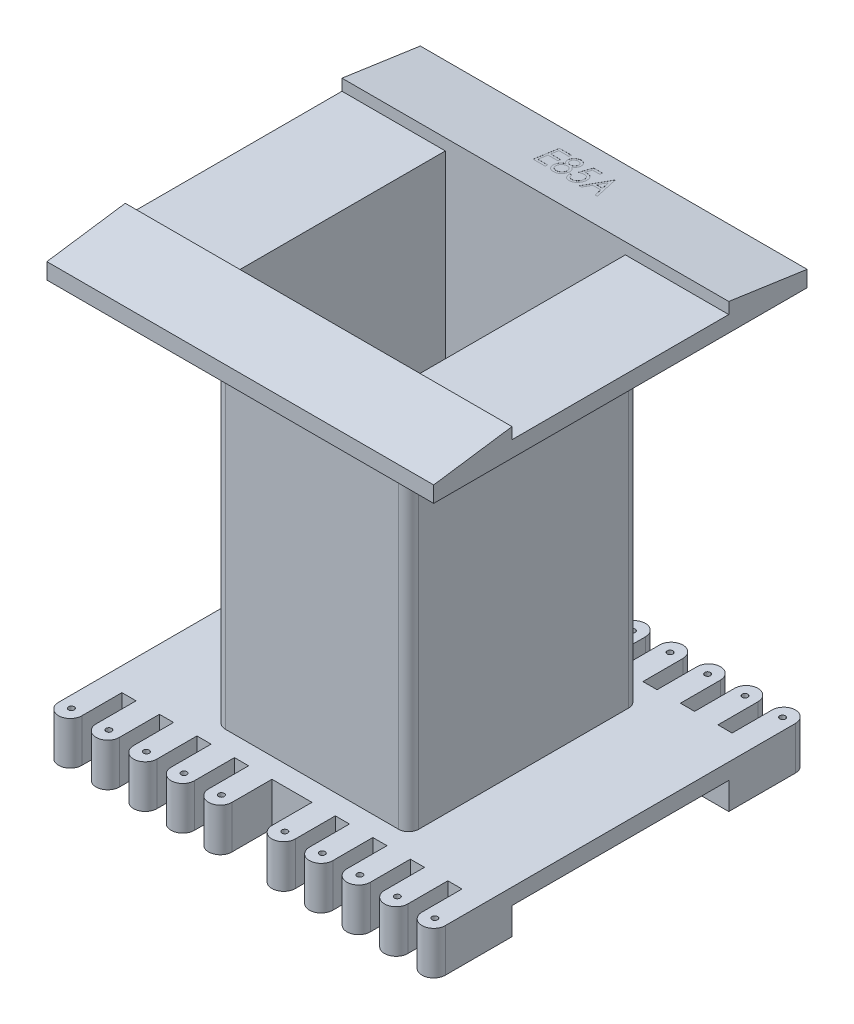
from build123d import *

# Parameters (mm, degrees)
SKETCH2_W           = 29
SKETCH2_H           = 34.5
SKETCH2_W_2         = 27
SKETCH2_H_2         = 32.5
BOSS_EXTRUDE1_DEPTH = 27.85
SKETCH4_W           = 58
SKETCH4_H           = 56
SKETCH4_W_2         = 27
SKETCH4_H_2         = 32.5
BOSS_EXTRUDE2_DEPTH = 2.4
BOSS_EXTRUDE3_DEPTH = 29
SKETCH7_R           = 0.425
CUT_EXTRUDE1_DEPTH  = 3
BOSS_EXTRUDE4_START = 4.05
BOSS_EXTRUDE4_DEPTH = 4.05
CUT_EXTRUDE2_DEPTH  = 0.01
CUT_EXTRUDE3_START  = -10
SKETCH10_R          = 0.425
CUT_EXTRUDE3_DEPTH  = 10
FILLET1_R           = 1.5


with BuildPart() as part:
    # Sketch2 → Boss-Extrude1 (new, symmetric)
    with BuildSketch(Plane(origin=(0, 0, 0), x_dir=(1, 0, 0), z_dir=(0, 1, 0))):
        Rectangle(SKETCH2_W, SKETCH2_H)
        Rectangle(SKETCH2_W_2, SKETCH2_H_2, mode=Mode.SUBTRACT)
    extrude(amount=BOSS_EXTRUDE1_DEPTH, both=True)

    # Sketch4 → Boss-Extrude2 (add)
    with BuildSketch(Plane(origin=(0, 27.85, 0), x_dir=(1, 0, 0), z_dir=(0, 1, 0))):
        Rectangle(SKETCH4_W, SKETCH4_H)
        Rectangle(SKETCH4_W_2, SKETCH4_H_2, mode=Mode.SUBTRACT)
    boss_extrude2 = extrude(amount=BOSS_EXTRUDE2_DEPTH)

    # Mirror1: Boss-Extrude2 across plane
    add(boss_extrude2.mirror(Plane.ZX))

    # Sketch5 → Boss-Extrude3 (add, symmetric)
    with BuildSketch(Plane(origin=(0, 0, 0), x_dir=(0, 0, -1), z_dir=(1, 0, 0))):
        Polygon((-28, 30.25), (-16.25, 31.95), (-16.25, 30.25), align=None)
        Polygon((28, 30.25), (16.25, 31.95), (16.25, 30.25), align=None)
    extrude(amount=BOSS_EXTRUDE3_DEPTH, both=True)

    # Sketch7 → Cut-Extrude1 (cut)
    with BuildSketch(Plane.XZ.offset(30.25)):
        with Locations((-27.25, 26.075)):
            Circle(SKETCH7_R)
        with Locations((-21.625, 26.075)):
            Circle(SKETCH7_R)
        with Locations((-16, 26.075)):
            Circle(SKETCH7_R)
        with Locations((-10.375, 26.075)):
            Circle(SKETCH7_R)
        with Locations((-4.75, 26.075)):
            Circle(SKETCH7_R)
        with Locations((21.625, 26.075)):
            Circle(SKETCH7_R)
        with Locations((16, 26.075)):
            Circle(SKETCH7_R)
        with Locations((10.375, 26.075)):
            Circle(SKETCH7_R)
        with Locations((4.75, 26.075)):
            Circle(SKETCH7_R)
        with Locations((27.25, 26.075)):
            Circle(SKETCH7_R)
        with Locations((27.25, -26.075)):
            Circle(SKETCH7_R)
        with Locations((4.75, -26.075)):
            Circle(SKETCH7_R)
        with Locations((10.375, -26.075)):
            Circle(SKETCH7_R)
        with Locations((16, -26.075)):
            Circle(SKETCH7_R)
        with Locations((21.625, -26.075)):
            Circle(SKETCH7_R)
        with Locations((-4.75, -26.075)):
            Circle(SKETCH7_R)
        with Locations((-10.375, -26.075)):
            Circle(SKETCH7_R)
        with Locations((-16, -26.075)):
            Circle(SKETCH7_R)
        with Locations((-21.625, -26.075)):
            Circle(SKETCH7_R)
        with Locations((-27.25, -26.075)):
            Circle(SKETCH7_R)
        with BuildLine():
            Line((-29, 28), (-29, 26.25))
            ThreePointArc((-29, 26.25), (-27.25, 28), (-25.5, 26.25))
            Line((-25.5, 26.25), (-25.5, 20.25))
            Line((-25.5, 20.25), (-23.375, 20.25))
            Line((-23.375, 20.25), (-23.375, 26.25))
            ThreePointArc((-23.375, 26.25), (-21.625, 28), (-19.875, 26.25))
            Line((-19.875, 26.25), (-19.875, 20.25))
            Line((-19.875, 20.25), (-17.75, 20.25))
            Line((-17.75, 20.25), (-17.75, 26.25))
            ThreePointArc((-17.75, 26.25), (-16, 28), (-14.25, 26.25))
            Line((-14.25, 26.25), (-14.25, 20.25))
            Line((-14.25, 20.25), (-12.125, 20.25))
            Line((-12.125, 20.25), (-12.125, 26.25))
            ThreePointArc((-12.125, 26.25), (-10.375, 28), (-8.625, 26.25))
            Line((-8.625, 26.25), (-8.625, 20.25))
            Line((-8.625, 20.25), (-6.5, 20.25))
            Line((-6.5, 20.25), (-6.5, 26.25))
            ThreePointArc((-6.5, 26.25), (-4.75, 28), (-3, 26.25))
            Line((-3, 26.25), (-3, 20.25))
            Line((-3, 20.25), (3, 20.25))
            Line((3, 20.25), (3, 26.25))
            ThreePointArc((3, 26.25), (4.75, 28), (6.5, 26.25))
            Line((6.5, 26.25), (6.5, 20.25))
            Line((6.5, 20.25), (8.625, 20.25))
            Line((8.625, 20.25), (8.625, 26.25))
            ThreePointArc((8.625, 26.25), (10.375, 28), (12.125, 26.25))
            Line((12.125, 26.25), (12.125, 20.25))
            Line((12.125, 20.25), (14.25, 20.25))
            Line((14.25, 20.25), (14.25, 26.25))
            ThreePointArc((14.25, 26.25), (16, 28), (17.75, 26.25))
            Line((17.75, 26.25), (17.75, 20.25))
            Line((17.75, 20.25), (19.875, 20.25))
            Line((19.875, 20.25), (19.875, 26.25))
            ThreePointArc((19.875, 26.25), (21.625, 28), (23.375, 26.25))
            Line((23.375, 26.25), (23.375, 20.25))
            Line((23.375, 20.25), (25.5, 20.25))
            Line((25.5, 20.25), (25.5, 26.25))
            ThreePointArc((25.5, 26.25), (27.25, 28), (29, 26.25))
            Line((29, 26.25), (29, 29.25))
            Line((29, 29.25), (-29, 29.25))
            Line((-29, 29.25), (-29, 28))
        make_face()
        with BuildLine():
            Line((3, -20.25), (3, -26.25))
            ThreePointArc((3, -26.25), (4.75, -28), (6.5, -26.25))
            Line((6.5, -26.25), (6.5, -20.25))
            Line((6.5, -20.25), (8.625, -20.25))
            Line((8.625, -20.25), (8.625, -26.25))
            ThreePointArc((8.625, -26.25), (10.375, -28), (12.125, -26.25))
            Line((12.125, -26.25), (12.125, -20.25))
            Line((12.125, -20.25), (14.25, -20.25))
            Line((14.25, -20.25), (14.25, -26.25))
            ThreePointArc((14.25, -26.25), (16, -28), (17.75, -26.25))
            Line((17.75, -26.25), (17.75, -20.25))
            Line((17.75, -20.25), (19.875, -20.25))
            Line((19.875, -20.25), (19.875, -26.25))
            ThreePointArc((19.875, -26.25), (21.625, -28), (23.375, -26.25))
            Line((23.375, -26.25), (23.375, -20.25))
            Line((23.375, -20.25), (25.5, -20.25))
            Line((25.5, -20.25), (25.5, -26.25))
            ThreePointArc((25.5, -26.25), (27.25, -28), (29, -26.25))
            Line((29, -26.25), (29, -29.25))
            Line((29, -29.25), (-29, -29.25))
            Line((-29, -29.25), (-29, -28))
            Line((-29, -28), (-29, -26.25))
            ThreePointArc((-29, -26.25), (-27.25, -28), (-25.5, -26.25))
            Line((-25.5, -26.25), (-25.5, -20.25))
            Line((-25.5, -20.25), (-23.375, -20.25))
            Line((-23.375, -20.25), (-23.375, -26.25))
            ThreePointArc((-23.375, -26.25), (-21.625, -28), (-19.875, -26.25))
            Line((-19.875, -26.25), (-19.875, -20.25))
            Line((-19.875, -20.25), (-17.75, -20.25))
            Line((-17.75, -20.25), (-17.75, -26.25))
            ThreePointArc((-17.75, -26.25), (-16, -28), (-14.25, -26.25))
            Line((-14.25, -26.25), (-14.25, -20.25))
            Line((-14.25, -20.25), (-12.125, -20.25))
            Line((-12.125, -20.25), (-12.125, -26.25))
            ThreePointArc((-12.125, -26.25), (-10.375, -28), (-8.625, -26.25))
            Line((-8.625, -26.25), (-8.625, -20.25))
            Line((-8.625, -20.25), (-6.5, -20.25))
            Line((-6.5, -20.25), (-6.5, -26.25))
            ThreePointArc((-6.5, -26.25), (-4.75, -28), (-3, -26.25))
            Line((-3, -26.25), (-3, -20.25))
            Line((-3, -20.25), (3, -20.25))
        make_face()
    extrude(amount=-CUT_EXTRUDE1_DEPTH, mode=Mode.SUBTRACT)

    # Sketch8 → Boss-Extrude4 (add)
    with BuildSketch(Plane.XZ.offset(30.25).offset(BOSS_EXTRUDE4_START)):
        with BuildLine():
            Line((-29, 16.25), (29, 16.25))
            Line((29, 16.25), (29, 26.25))
            ThreePointArc((29, 26.25), (27.25, 28), (25.5, 26.25))
            Line((25.5, 26.25), (25.5, 20.25))
            Line((25.5, 20.25), (23.375, 20.25))
            Line((23.375, 20.25), (23.375, 26.25))
            ThreePointArc((23.375, 26.25), (21.625, 28), (19.875, 26.25))
            Line((19.875, 26.25), (19.875, 20.25))
            Line((19.875, 20.25), (17.75, 20.25))
            Line((17.75, 20.25), (17.75, 26.25))
            ThreePointArc((17.75, 26.25), (16, 28), (14.25, 26.25))
            Line((14.25, 26.25), (14.25, 20.25))
            Line((14.25, 20.25), (12.125, 20.25))
            Line((12.125, 20.25), (12.125, 26.25))
            ThreePointArc((12.125, 26.25), (10.375, 28), (8.625, 26.25))
            Line((8.625, 26.25), (8.625, 20.25))
            Line((8.625, 20.25), (6.5, 20.25))
            Line((6.5, 20.25), (6.5, 26.25))
            ThreePointArc((6.5, 26.25), (4.75, 28), (3, 26.25))
            Line((3, 26.25), (3, 20.25))
            Line((3, 20.25), (-3, 20.25))
            Line((-3, 20.25), (-3, 26.25))
            ThreePointArc((-3, 26.25), (-4.75, 28), (-6.5, 26.25))
            Line((-6.5, 26.25), (-6.5, 20.25))
            Line((-6.5, 20.25), (-8.625, 20.25))
            Line((-8.625, 20.25), (-8.625, 26.25))
            ThreePointArc((-8.625, 26.25), (-10.375, 28), (-12.125, 26.25))
            Line((-12.125, 26.25), (-12.125, 20.25))
            Line((-12.125, 20.25), (-14.25, 20.25))
            Line((-14.25, 20.25), (-14.25, 26.25))
            ThreePointArc((-14.25, 26.25), (-16, 28), (-17.75, 26.25))
            Line((-17.75, 26.25), (-17.75, 20.25))
            Line((-17.75, 20.25), (-19.875, 20.25))
            Line((-19.875, 20.25), (-19.875, 26.25))
            ThreePointArc((-19.875, 26.25), (-21.625, 28), (-23.375, 26.25))
            Line((-23.375, 26.25), (-23.375, 20.25))
            Line((-23.375, 20.25), (-25.5, 20.25))
            Line((-25.5, 20.25), (-25.5, 26.25))
            ThreePointArc((-25.5, 26.25), (-27.25, 28), (-29, 26.25))
            Line((-29, 26.25), (-29, 16.25))
        make_face()
        with BuildLine():
            Line((-25.5, -20.25), (-25.5, -26.25))
            ThreePointArc((-25.5, -26.25), (-27.25, -28), (-29, -26.25))
            Line((-29, -26.25), (-29, -16.25))
            Line((-29, -16.25), (29, -16.25))
            Line((29, -16.25), (29, -26.25))
            ThreePointArc((29, -26.25), (27.25, -28), (25.5, -26.25))
            Line((25.5, -26.25), (25.5, -20.25))
            Line((25.5, -20.25), (23.375, -20.25))
            Line((23.375, -20.25), (23.375, -26.25))
            ThreePointArc((23.375, -26.25), (21.625, -28), (19.875, -26.25))
            Line((19.875, -26.25), (19.875, -20.25))
            Line((19.875, -20.25), (17.75, -20.25))
            Line((17.75, -20.25), (17.75, -26.25))
            ThreePointArc((17.75, -26.25), (16, -28), (14.25, -26.25))
            Line((14.25, -26.25), (14.25, -20.25))
            Line((14.25, -20.25), (12.125, -20.25))
            Line((12.125, -20.25), (12.125, -26.25))
            ThreePointArc((12.125, -26.25), (10.375, -28), (8.625, -26.25))
            Line((8.625, -26.25), (8.625, -20.25))
            Line((8.625, -20.25), (6.5, -20.25))
            Line((6.5, -20.25), (6.5, -26.25))
            ThreePointArc((6.5, -26.25), (4.75, -28), (3, -26.25))
            Line((3, -26.25), (3, -20.25))
            Line((3, -20.25), (-3, -20.25))
            Line((-3, -20.25), (-3, -26.25))
            ThreePointArc((-3, -26.25), (-4.75, -28), (-6.5, -26.25))
            Line((-6.5, -26.25), (-6.5, -20.25))
            Line((-6.5, -20.25), (-8.625, -20.25))
            Line((-8.625, -20.25), (-8.625, -26.25))
            ThreePointArc((-8.625, -26.25), (-10.375, -28), (-12.125, -26.25))
            Line((-12.125, -26.25), (-12.125, -20.25))
            Line((-12.125, -20.25), (-14.25, -20.25))
            Line((-14.25, -20.25), (-14.25, -26.25))
            ThreePointArc((-14.25, -26.25), (-16, -28), (-17.75, -26.25))
            Line((-17.75, -26.25), (-17.75, -20.25))
            Line((-17.75, -20.25), (-19.875, -20.25))
            Line((-19.875, -20.25), (-19.875, -26.25))
            ThreePointArc((-19.875, -26.25), (-21.625, -28), (-23.375, -26.25))
            Line((-23.375, -26.25), (-23.375, -20.25))
            Line((-23.375, -20.25), (-25.5, -20.25))
        make_face()
    extrude(amount=-BOSS_EXTRUDE4_DEPTH)

    # Sketch9 → Cut-Extrude2 (cut)
    # profile 1 of 4: a face of its own
    with BuildSketch(Plane(origin=(0, 33.597776733, -4.860954932), x_dir=(1, 0, 0), z_dir=(0, 0.9896952252782922, -0.1431899474870726))):
        Polygon((-4.794871795, 20.007628589), (-3, 20.007628589), (-3, 19.597372178), (-4.487179487, 19.597372178), (-4.487179487, 18.366602948), (-3, 18.366602948), (-3, 17.956346537), (-4.487179487, 17.956346537), (-4.487179487, 16.417884999), (-3, 16.417884999), (-3, 16.007628589), (-4.794871795, 16.007628589), align=None)
    # profile 2 of 4: a face of its own
    with BuildSketch(Plane(origin=(0, 33.597776733, -4.860954932), x_dir=(1, 0, 0), z_dir=(0, 0.9896952252782922, -0.1431899474870726))):
        with BuildLine():
            add(Edge.make_bspline(
                [(-1.185096154, 18.235993973), (-1.135626284, 18.201852027), (-1.04005113, 18.135890224), (-0.914790112, 18.021584211), (-0.810265914, 17.900748708), (-0.728041652, 17.771112207), (-0.665735209, 17.63395375), (-0.621571795, 17.488231069), (-0.594527612, 17.333419737), (-0.591360756, 17.227024024), (-0.58974359, 17.172692691)],
                knots=[0, 0, 0, 0, 1.128817125, 2.180860238, 3.177988592, 4.123737061, 5.056171269, 6.001159785, 6.979285454, 8, 8, 8, 8], degree=3))
            add(Edge.make_bspline(
                [(-0.58974359, 17.172692691), (-0.59064271, 17.134211809), (-0.592419208, 17.058180641), (-0.602642688, 16.945648871), (-0.621142605, 16.836688367), (-0.647046954, 16.73098135), (-0.679464719, 16.628757637), (-0.720106353, 16.529977654), (-0.76781206, 16.434865008), (-0.805107424, 16.374359515), (-0.823717949, 16.34416705)],
                knots=[0, 0, 0, 0, 1.057772661, 2.089964817, 3.102547595, 4.092524029, 5.079228706, 6.047156722, 7.025523981, 8, 8, 8, 8], degree=3))
            add(Edge.make_bspline(
                [(-0.823717949, 16.34416705), (-0.848331695, 16.309383026), (-0.896545895, 16.241246958), (-0.980326536, 16.151126171), (-1.071832239, 16.074410408), (-1.171885186, 16.012601751), (-1.279365151, 15.964144919), (-1.394289356, 15.929346179), (-1.517199317, 15.909374324), (-1.601690308, 15.906525738), (-1.645032051, 15.905064486)],
                knots=[0, 0, 0, 0, 1.048906327, 2.054631539, 3.021839926, 3.982309668, 4.942418687, 5.918716991, 6.932354415, 8, 8, 8, 8], degree=3))
            add(Edge.make_bspline(
                [(-1.645032051, 15.905064486), (-1.686755969, 15.906373697), (-1.767918209, 15.908920401), (-1.886102142, 15.926448085), (-1.995989766, 15.957015108), (-2.098668658, 15.99876139), (-2.192974343, 16.053964472), (-2.279823877, 16.120561358), (-2.358694892, 16.199547583), (-2.42790694, 16.2898872), (-2.489619851, 16.386824312), (-2.54350424, 16.487385616), (-2.589289403, 16.590222732), (-2.62730228, 16.695338031), (-2.656033908, 16.803189219), (-2.676777414, 16.913255483), (-2.690262242, 17.025723105), (-2.691622402, 17.101607305), (-2.692307692, 17.139840127)],
                knots=[0, 0, 0, 0, 1.104708739, 2.14890257, 3.154370595, 4.118367704, 5.075413289, 6.038709714, 7.008861323, 8.021763411, 9.045837506, 10.048840199, 11.039777576, 12.024055369, 13.005330523, 13.991512021, 14.988061252, 16, 16, 16, 16], degree=3))
            add(Edge.make_bspline(
                [(-2.692307692, 17.139840127), (-2.690667664, 17.195230225), (-2.68745512, 17.303730225), (-2.660659375, 17.462151967), (-2.615114723, 17.61145173), (-2.563811585, 17.729710422), (-2.512761874, 17.819359516), (-2.468221188, 17.884460036), (-2.41849553, 17.948202098), (-2.362107521, 18.00937015), (-2.301387434, 18.069853648), (-2.234270156, 18.127685862), (-2.161758858, 18.183586499), (-2.11023677, 18.218371283), (-2.084134615, 18.235993973)],
                knots=[0, 0, 0, 0, 1.517674003, 2.972871206, 4.388029641, 5.787820883, 6.496147795, 7.212975084, 7.948222945, 8.710108948, 9.49185787, 10.296315951, 11.136878426, 12, 12, 12, 12], degree=3))
            add(Edge.make_bspline(
                [(-2.084134615, 18.235993973), (-2.1204404, 18.261472112), (-2.191744723, 18.311511009), (-2.283763742, 18.401969311), (-2.363876067, 18.499269072), (-2.427598718, 18.60637348), (-2.477370021, 18.719517645), (-2.512814344, 18.837365706), (-2.534212316, 18.959306721), (-2.537035894, 19.041998642), (-2.538461538, 19.083750383)],
                knots=[0, 0, 0, 0, 1.058972266, 2.079814596, 3.074322664, 4.065626078, 5.049411374, 6.023340544, 7.001970524, 8, 8, 8, 8], degree=3))
            add(Edge.make_bspline(
                [(-2.538461538, 19.083750383), (-2.537250877, 19.126342114), (-2.534826501, 19.21163292), (-2.509490862, 19.3381725), (-2.473659219, 19.463975095), (-2.420052602, 19.585426953), (-2.356128477, 19.701122593), (-2.277408793, 19.804514408), (-2.187838154, 19.89522039), (-2.087745442, 19.971868322), (-1.980063581, 20.034226287), (-1.86570671, 20.077268678), (-1.747607768, 20.105291935), (-1.6670907, 20.108552906), (-1.626602564, 20.110192691)],
                knots=[0, 0, 0, 0, 1.006801535, 2.016140496, 3.04434944, 4.097767983, 5.150882958, 6.16620321, 7.163091172, 8.159497914, 9.142029795, 10.096562843, 11.042853592, 12, 12, 12, 12], degree=3))
            add(Edge.make_bspline(
                [(-1.626602564, 20.110192691), (-1.586927915, 20.108523363), (-1.50828014, 20.105214224), (-1.392872522, 20.07781693), (-1.283001498, 20.03213872), (-1.178853838, 19.970050185), (-1.081763115, 19.893544146), (-0.996006953, 19.801774232), (-0.919694516, 19.698765394), (-0.857553258, 19.583613536), (-0.807170964, 19.461360227), (-0.770066589, 19.334692552), (-0.747708729, 19.2044679), (-0.744968292, 19.1166888), (-0.743589744, 19.072532435)],
                knots=[0, 0, 0, 0, 0.945268751, 1.87382339, 2.810620796, 3.772987939, 4.756784404, 5.747996242, 6.759505551, 7.805656055, 8.859553138, 9.907698875, 10.947489625, 12, 12, 12, 12], degree=3))
            add(Edge.make_bspline(
                [(-0.743589744, 19.072532435), (-0.74508208, 19.029197697), (-0.748000338, 18.944456794), (-0.767722762, 18.820608201), (-0.80368054, 18.704638556), (-0.851869477, 18.595433384), (-0.913792032, 18.493340175), (-0.991704326, 18.400117629), (-1.080947463, 18.311738925), (-1.149923897, 18.261573948), (-1.185096154, 18.235993973)],
                knots=[0, 0, 0, 0, 1.053501153, 2.060117211, 3.037794984, 3.997036466, 4.955838333, 5.929389179, 6.944160328, 8, 8, 8, 8], degree=3))
        make_face()
        with BuildLine():
            add(Edge.make_bspline(
                [(-1.641826923, 19.699936281), (-1.662678905, 19.699197834), (-1.703467153, 19.697753369), (-1.763494128, 19.690013457), (-1.82055157, 19.675181513), (-1.87547098, 19.655606134), (-1.926699457, 19.62832966), (-1.976294575, 19.597478644), (-2.021917258, 19.559074813), (-2.078811567, 19.502266948), (-2.139655068, 19.422456873), (-2.192601817, 19.315651037), (-2.225176639, 19.199691212), (-2.228879214, 19.119219176), (-2.230769231, 19.078141409)],
                knots=[0, 0, 0, 0, 0.787074358, 1.539584277, 2.277719126, 3.007830531, 3.733477235, 4.463101644, 5.207606632, 5.977196966, 7.494883027, 8.968605234, 10.452593816, 12, 12, 12, 12], degree=3))
            add(Edge.make_bspline(
                [(-2.230769231, 19.078141409), (-2.228665957, 19.037034594), (-2.224482932, 18.955280663), (-2.188867873, 18.836211026), (-2.132035496, 18.723291683), (-2.06664942, 18.637429391), (-2.007012568, 18.573995927), (-1.959078513, 18.532191384), (-1.908625945, 18.497340971), (-1.85683746, 18.468595654), (-1.803255728, 18.445562037), (-1.747788553, 18.429714984), (-1.690270484, 18.419633197), (-1.651217522, 18.418473291), (-1.631410256, 18.417884999)],
                knots=[0, 0, 0, 0, 1.503377697, 2.989943038, 4.512810598, 6.113657223, 6.923460787, 7.700377033, 8.438683534, 9.16575144, 9.867283722, 10.570247634, 11.274844133, 12, 12, 12, 12], degree=3))
            add(Edge.make_bspline(
                [(-1.631410256, 18.417884999), (-1.606196254, 18.418894569), (-1.555679017, 18.420917283), (-1.481427597, 18.439591226), (-1.409376955, 18.468638486), (-1.340505481, 18.509095898), (-1.275827454, 18.558917379), (-1.218726845, 18.619107286), (-1.168468483, 18.687086274), (-1.126631667, 18.762673354), (-1.09368888, 18.84245244), (-1.069129611, 18.923427808), (-1.054125349, 19.004665722), (-1.052225424, 19.059117287), (-1.051282051, 19.08615423)],
                knots=[0, 0, 0, 0, 0.926959826, 1.857200198, 2.801319747, 3.77959719, 4.788725481, 5.797230661, 6.823935113, 7.893723746, 8.969417254, 9.996121706, 11.005010385, 12, 12, 12, 12], degree=3))
            add(Edge.make_bspline(
                [(-1.051282051, 19.08615423), (-1.053161529, 19.123719486), (-1.056893494, 19.198310538), (-1.086111821, 19.307517918), (-1.134580984, 19.411443283), (-1.189027327, 19.492712267), (-1.241693246, 19.552236824), (-1.286152831, 19.592046725), (-1.334999432, 19.625449965), (-1.387986913, 19.653626772), (-1.445735382, 19.673659775), (-1.507300952, 19.689427788), (-1.5732138, 19.697954999), (-1.618567984, 19.699264653), (-1.641826923, 19.699936281)],
                knots=[0, 0, 0, 0, 1.41789026, 2.815418751, 4.237647105, 5.734964885, 6.492513555, 7.235814941, 7.983146572, 8.723359292, 9.495815479, 10.286317727, 11.121174114, 12, 12, 12, 12], degree=3))
        make_face(mode=Mode.SUBTRACT)
        with BuildLine():
            add(Edge.make_bspline(
                [(-1.625, 18.007628589), (-1.65151015, 18.007003739), (-1.703521085, 18.00577783), (-1.779607047, 17.991769254), (-1.852853842, 17.972614255), (-1.922621411, 17.942921502), (-1.989125385, 17.905419129), (-2.052035627, 17.858822001), (-2.112337363, 17.805351839), (-2.167780198, 17.743582499), (-2.218571481, 17.677205466), (-2.262946944, 17.606877609), (-2.300775648, 17.534073201), (-2.331270711, 17.458045931), (-2.3555483, 17.379584884), (-2.372073535, 17.29796663), (-2.383044784, 17.213858128), (-2.384088156, 17.156702393), (-2.384615385, 17.127820896)],
                knots=[0, 0, 0, 0, 0.9847572, 1.932020036, 2.869543467, 3.795734653, 4.743309996, 5.703045184, 6.702129772, 7.735926045, 8.785026717, 9.807544264, 10.825030468, 11.832280622, 12.85044557, 13.875276944, 14.92635129, 16, 16, 16, 16], degree=3))
            add(Edge.make_bspline(
                [(-2.384615385, 17.127820896), (-2.383664751, 17.091945543), (-2.381787006, 17.021082528), (-2.362859469, 16.916412856), (-2.334711629, 16.814501674), (-2.293421554, 16.717178865), (-2.243560417, 16.626025716), (-2.181220632, 16.546012142), (-2.111757652, 16.475142972), (-2.031490856, 16.417500612), (-1.944013646, 16.3712137), (-1.84888696, 16.339661319), (-1.747732644, 16.318422847), (-1.677731807, 16.316372541), (-1.641826923, 16.315320896)],
                knots=[0, 0, 0, 0, 1.046503232, 2.067112015, 3.096621624, 4.12790218, 5.147527128, 6.120914979, 7.080488514, 8.035200521, 8.994520469, 9.958867953, 10.953060937, 12, 12, 12, 12], degree=3))
            add(Edge.make_bspline(
                [(-1.641826923, 16.315320896), (-1.614000863, 16.316040588), (-1.559679327, 16.317445559), (-1.480434778, 16.329891922), (-1.405561893, 16.34959538), (-1.33540054, 16.378234292), (-1.268730332, 16.413380932), (-1.207344684, 16.457929142), (-1.149415402, 16.509430766), (-1.098513051, 16.569807741), (-1.051110681, 16.634039724), (-1.010609789, 16.702575825), (-0.974680423, 16.772832708), (-0.947142874, 16.846469446), (-0.923841724, 16.92197035), (-0.909463614, 17.000807385), (-0.899104892, 17.082140919), (-0.897998233, 17.137401257), (-0.897435897, 17.165481153)],
                knots=[0, 0, 0, 0, 1.057208993, 2.063864431, 3.041686247, 3.993867019, 4.938765438, 5.899569259, 6.870141775, 7.877872017, 8.895376391, 9.901878192, 10.900874436, 11.890851383, 12.886746751, 13.900342611, 14.933083623, 16, 16, 16, 16], degree=3))
            add(Edge.make_bspline(
                [(-0.897435897, 17.165481153), (-0.897924631, 17.192768171), (-0.89888668, 17.246481478), (-0.910344564, 17.325656745), (-0.925671947, 17.402824779), (-0.949150056, 17.477701991), (-0.979853384, 17.549944642), (-1.016839264, 17.61991565), (-1.060325784, 17.687422638), (-1.109634942, 17.751724217), (-1.163270948, 17.81149727), (-1.221136347, 17.863696893), (-1.281452612, 17.908150943), (-1.344477698, 17.944725322), (-1.410673709, 17.973000802), (-1.479842369, 17.992907109), (-1.551632484, 18.005396548), (-1.600376633, 18.006879478), (-1.625, 18.007628589)],
                knots=[0, 0, 0, 0, 1.062772706, 2.092021773, 3.112970097, 4.127207538, 5.144326494, 6.168931198, 7.208606358, 8.270613836, 9.324630021, 10.334529776, 11.302840154, 12.240380969, 13.168626316, 14.101066092, 15.040743392, 16, 16, 16, 16], degree=3))
        make_face(mode=Mode.SUBTRACT)
    # profile 3 of 4: a face of its own
    with BuildSketch(Plane(origin=(0, 33.597776733, -4.860954932), x_dir=(1, 0, 0), z_dir=(0, 0.9896952252782922, -0.1431899474870726))):
        with BuildLine():
            Line((1.666666667, 20.007628589), (1.666666667, 19.597372178))
            Line((1.666666667, 19.597372178), (0.582532051, 19.597372178))
            Line((0.582532051, 19.597372178), (0.420673077, 18.542083717))
            add(Edge.make_bspline(
                [(0.420673077, 18.542083717), (0.453617749, 18.554371544), (0.517175224, 18.578077449), (0.611750519, 18.603665496), (0.701606708, 18.620202267), (0.760084117, 18.622094808), (0.788461538, 18.623013204)],
                knots=[0, 0, 0, 0, 1.113577535, 2.148334562, 3.101439487, 4, 4, 4, 4], degree=3))
            add(Edge.make_bspline(
                [(0.788461538, 18.623013204), (0.823266725, 18.622057252), (0.891740394, 18.62017657), (0.992021095, 18.601623776), (1.087852896, 18.572957439), (1.178924637, 18.532712639), (1.26500229, 18.480638121), (1.345957709, 18.416607291), (1.423466548, 18.342047245), (1.493898732, 18.255293602), (1.5584294, 18.160772742), (1.614984032, 18.058825057), (1.662806587, 17.950721929), (1.702692059, 17.836186227), (1.731688646, 17.71470574), (1.753144296, 17.587014592), (1.767491707, 17.452931962), (1.768643015, 17.361299095), (1.769230769, 17.314519614)],
                knots=[0, 0, 0, 0, 0.915452749, 1.801007638, 2.675239231, 3.544138018, 4.414827501, 5.316484203, 6.256349044, 7.24041834, 8.25264956, 9.266198822, 10.305020537, 11.361306631, 12.454513165, 13.588568039, 14.768940248, 16, 16, 16, 16], degree=3))
            add(Edge.make_bspline(
                [(1.769230769, 17.314519614), (1.767666555, 17.249782128), (1.764588309, 17.122384028), (1.736443679, 16.935790627), (1.69151676, 16.75723734), (1.629702124, 16.588712514), (1.552841282, 16.433502296), (1.461871583, 16.296196058), (1.35885148, 16.176906506), (1.260456918, 16.09543516), (1.178009436, 16.038534706), (1.112648947, 16.003999792), (1.045883059, 15.972722703), (0.976262367, 15.948316833), (0.904529838, 15.928727414), (0.830227331, 15.915501524), (0.753717965, 15.90599069), (0.701686145, 15.905374716), (0.675480769, 15.905064486)],
                knots=[0, 0, 0, 0, 1.560107059, 3.070163622, 4.538401596, 5.993174223, 7.390017185, 8.704628562, 9.955064718, 11.175437472, 11.773810098, 12.367450782, 12.955334644, 13.550126979, 14.143767662, 14.746284672, 15.368577114, 16, 16, 16, 16], degree=3))
            add(Edge.make_bspline(
                [(0.675480769, 15.905064486), (0.644156666, 15.905858746), (0.5824586, 15.907423175), (0.492325901, 15.923679184), (0.4054898, 15.947284281), (0.322800471, 15.982198169), (0.243361593, 16.026617446), (0.168357606, 16.081542471), (0.096177778, 16.145162533), (0.02957855, 16.21911855), (-0.032668997, 16.300101334), (-0.08795816, 16.388057998), (-0.137210194, 16.481456865), (-0.179280556, 16.58079089), (-0.215660161, 16.685665557), (-0.245213802, 16.796229989), (-0.267689049, 16.912753175), (-0.277204527, 16.992599498), (-0.282051282, 17.033269614)],
                knots=[0, 0, 0, 0, 0.923275421, 1.818545566, 2.694317439, 3.573945876, 4.459590681, 5.373909434, 6.311768093, 7.29356341, 8.305513485, 9.322178447, 10.355055801, 11.417807359, 12.501966515, 13.627940912, 14.791780093, 16, 16, 16, 16], degree=3))
            Line((-0.282051282, 17.033269614), (0.025641026, 17.033269614))
            add(Edge.make_bspline(
                [(0.025641026, 17.033269614), (0.032197533, 16.995203511), (0.044729508, 16.922444731), (0.073133425, 16.819790427), (0.107151069, 16.728057799), (0.148132056, 16.646541951), (0.197187112, 16.575315699), (0.252177725, 16.51100701), (0.314704779, 16.45392879), (0.384472293, 16.405517973), (0.457997339, 16.365099911), (0.535388559, 16.337198977), (0.61394664, 16.318353164), (0.667361991, 16.316327622), (0.693910256, 16.315320896)],
                knots=[0, 0, 0, 0, 1.295040219, 2.475313703, 3.5669374, 4.572676558, 5.526934895, 6.460829183, 7.40583148, 8.357815864, 9.30383694, 10.210915259, 11.110796898, 12, 12, 12, 12], degree=3))
            add(Edge.make_bspline(
                [(0.693910256, 16.315320896), (0.71988254, 16.316267719), (0.771120406, 16.318135601), (0.846178643, 16.332294491), (0.918533239, 16.354620626), (0.987366587, 16.38753121), (1.054990616, 16.427220757), (1.117706105, 16.478845636), (1.179411436, 16.537273791), (1.236147531, 16.605246784), (1.288812528, 16.679353931), (1.335783442, 16.758599553), (1.373744225, 16.843368076), (1.406300242, 16.931819747), (1.430990782, 17.024938719), (1.448265091, 17.122518643), (1.460247288, 17.224479318), (1.461102289, 17.294184442), (1.461538462, 17.329743973)],
                knots=[0, 0, 0, 0, 0.883627968, 1.743212611, 2.591519239, 3.453888357, 4.334892888, 5.253609023, 6.211746337, 7.224577056, 8.261445484, 9.30467269, 10.354377667, 11.418591148, 12.510297713, 13.628489155, 14.790192039, 16, 16, 16, 16], degree=3))
            add(Edge.make_bspline(
                [(1.461538462, 17.329743973), (1.460953549, 17.361820459), (1.459810209, 17.424520956), (1.449996428, 17.51614072), (1.434147699, 17.602992146), (1.411647265, 17.685320617), (1.38267747, 17.762942552), (1.348466534, 17.836651038), (1.306455005, 17.904941114), (1.258302116, 17.967927948), (1.205982354, 18.025912701), (1.147987594, 18.075819757), (1.085316194, 18.117735911), (1.019173807, 18.153540643), (0.947731962, 18.179610716), (0.872684124, 18.199249605), (0.793063111, 18.210323266), (0.738547316, 18.211934735), (0.710737179, 18.212756794)],
                knots=[0, 0, 0, 0, 1.180781187, 2.308094721, 3.388266191, 4.428481563, 5.445995518, 6.435805344, 7.415746039, 8.391334499, 9.351887262, 10.286308742, 11.200059834, 12.123916071, 13.048190959, 13.992752428, 14.976043021, 16, 16, 16, 16], degree=3))
            add(Edge.make_bspline(
                [(0.710737179, 18.212756794), (0.686401663, 18.212111407), (0.636483764, 18.210787566), (0.559904844, 18.200487668), (0.479863999, 18.18450088), (0.396187651, 18.161696767), (0.308763677, 18.132710642), (0.217404595, 18.097210689), (0.122106409, 18.055763967), (0.058352979, 18.023951566), (0.025641026, 18.007628589)],
                knots=[0, 0, 0, 0, 0.80946005, 1.660394019, 2.566651373, 3.523765815, 4.543866754, 5.629776835, 6.783835928, 8, 8, 8, 8], degree=3))
            Line((0.025641026, 18.007628589), (0.333333333, 20.007628589))
            Line((0.333333333, 20.007628589), (1.666666667, 20.007628589))
        make_face()
    # profile 4 of 4: a face of its own
    with BuildSketch(Plane(origin=(0, 33.597776733, -4.860954932), x_dir=(1, 0, 0), z_dir=(0, 0.9896952252782922, -0.1431899474870726))):
        Polygon((3.512820513, 20.007628589), (4.846153846, 16.007628589), (4.511217949, 16.007628589), (4.084134615, 17.289679871), (2.890224359, 17.289679871), (2.463141026, 16.007628589), (2.128205128, 16.007628589), (3.461538462, 20.007628589), align=None)
        Polygon((3.487179487, 19.079743973), (3.02724359, 17.699936281), (3.947115385, 17.699936281), align=None, mode=Mode.SUBTRACT)
    extrude(amount=-CUT_EXTRUDE2_DEPTH, mode=Mode.SUBTRACT)

    # Sketch10 → Cut-Extrude3 (cut)
    with BuildSketch(Plane(origin=(0, -27.85, 0), x_dir=(1, 0, 0), z_dir=(0, 1, 0)).offset(CUT_EXTRUDE3_START)):
        with Locations((27.25, -26.075)):
            Circle(SKETCH10_R)
        with Locations((21.625, -26.075)):
            Circle(SKETCH10_R)
        with Locations((16, -26.075)):
            Circle(SKETCH10_R)
        with Locations((10.375, -26.075)):
            Circle(SKETCH10_R)
        with Locations((4.75, -26.075)):
            Circle(SKETCH10_R)
        with Locations((-4.75, -26.075)):
            Circle(SKETCH10_R)
        with Locations((-10.375, -26.075)):
            Circle(SKETCH10_R)
        with Locations((-16, -26.075)):
            Circle(SKETCH10_R)
        with Locations((-21.625, -26.075)):
            Circle(SKETCH10_R)
        with Locations((-27.25, -26.075)):
            Circle(SKETCH10_R)
        with Locations((27.25, 26.075)):
            Circle(SKETCH10_R)
        with Locations((21.625, 26.075)):
            Circle(SKETCH10_R)
        with Locations((16, 26.075)):
            Circle(SKETCH10_R)
        with Locations((10.375, 26.075)):
            Circle(SKETCH10_R)
        with Locations((4.75, 26.075)):
            Circle(SKETCH10_R)
        with Locations((-4.75, 26.075)):
            Circle(SKETCH10_R)
        with Locations((-10.375, 26.075)):
            Circle(SKETCH10_R)
        with Locations((-16, 26.075)):
            Circle(SKETCH10_R)
        with Locations((-21.625, 26.075)):
            Circle(SKETCH10_R)
        with Locations((-27.25, 26.075)):
            Circle(SKETCH10_R)
    extrude(amount=CUT_EXTRUDE3_DEPTH, mode=Mode.SUBTRACT)

    # Fillet1
    fillet1_edges = [part.edges().sort_by_distance(p)[0] for p in [
        (-14.5, 0, 17.25),
        (-14.5, 0, -17.25),
        (14.5, 0, -17.25),
        (14.5, 0, 17.25),
    ]]
    fillet(fillet1_edges, radius=FILLET1_R)


solid = part.part
